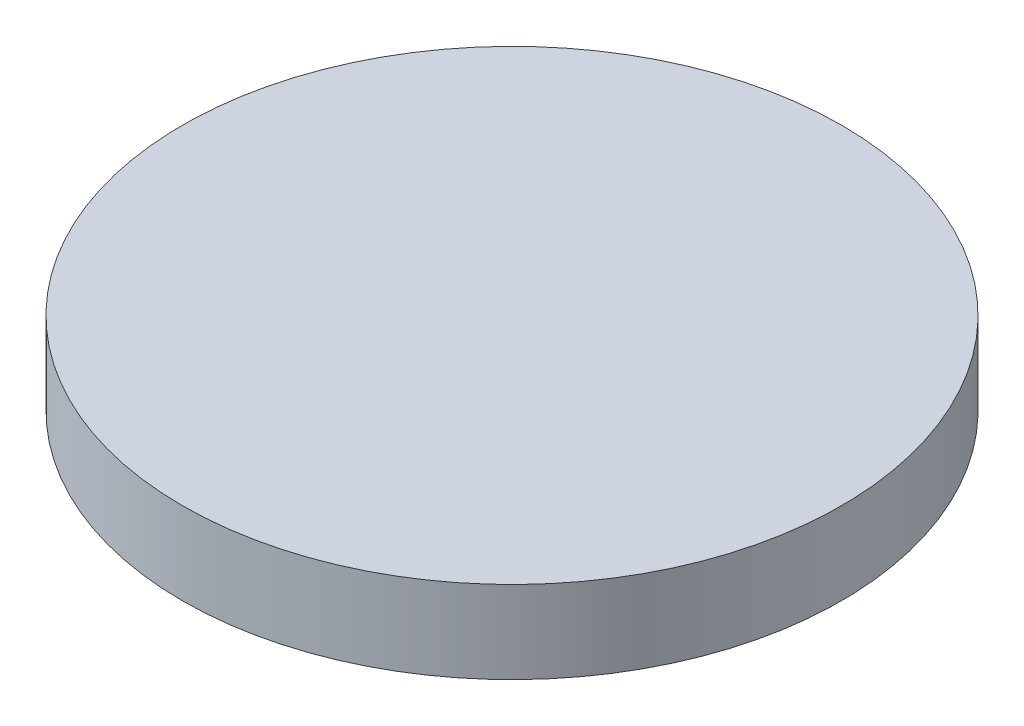
from build123d import *

# Parameters (mm, degrees)
F_3DSKETCH1_R       = 20
BOSS_EXTRUDE1_DEPTH = 5


with BuildPart() as part:
    # 3DSketch1 → Boss-Extrude1 (new body)
    with BuildSketch(Plane.ZX):
        Circle(F_3DSKETCH1_R)
    extrude(amount=-BOSS_EXTRUDE1_DEPTH)


solid = part.part
